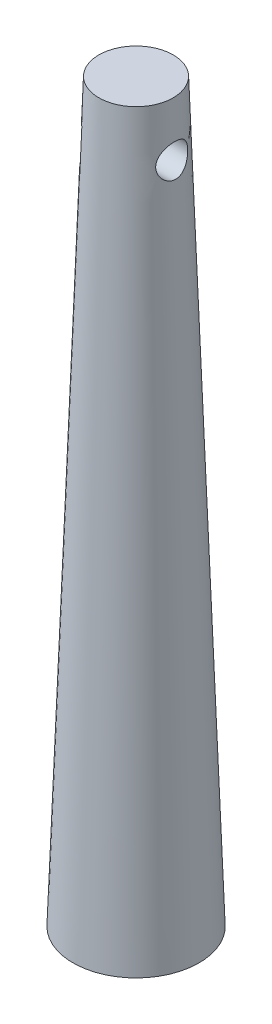
from build123d import *

# Parameters (mm, degrees)
CUT_EXTRUDE1_DEPTH      = 71.66729416
CUT_EXTRUDE1_DEPTH_BACK = 71.66729416
SKETCH2_R               = 1.524


with BuildPart() as part:
    # Sketch1 → Revolve1 (revolve)
    with BuildSketch(Plane.XY):
        Polygon((0, 0), (0, 70.1548), (3.5433, 70.1548), (6.0071, 0), align=None)
    revolve(axis=Axis((0, 0, 0), (0, 1, 0)))

    # Sketch2 → Cut-Extrude1 (cut, two sides: drawn at the far end of the back side and taken through both)
    with BuildSketch(Plane(origin=(0, 0, 0), x_dir=(0, 0, -1), z_dir=(1, 0, 0)).offset(-CUT_EXTRUDE1_DEPTH_BACK)):
        with Locations((0, 65.0748)):
            Circle(SKETCH2_R)
    extrude(amount=CUT_EXTRUDE1_DEPTH + CUT_EXTRUDE1_DEPTH_BACK, mode=Mode.SUBTRACT)


solid = part.part
